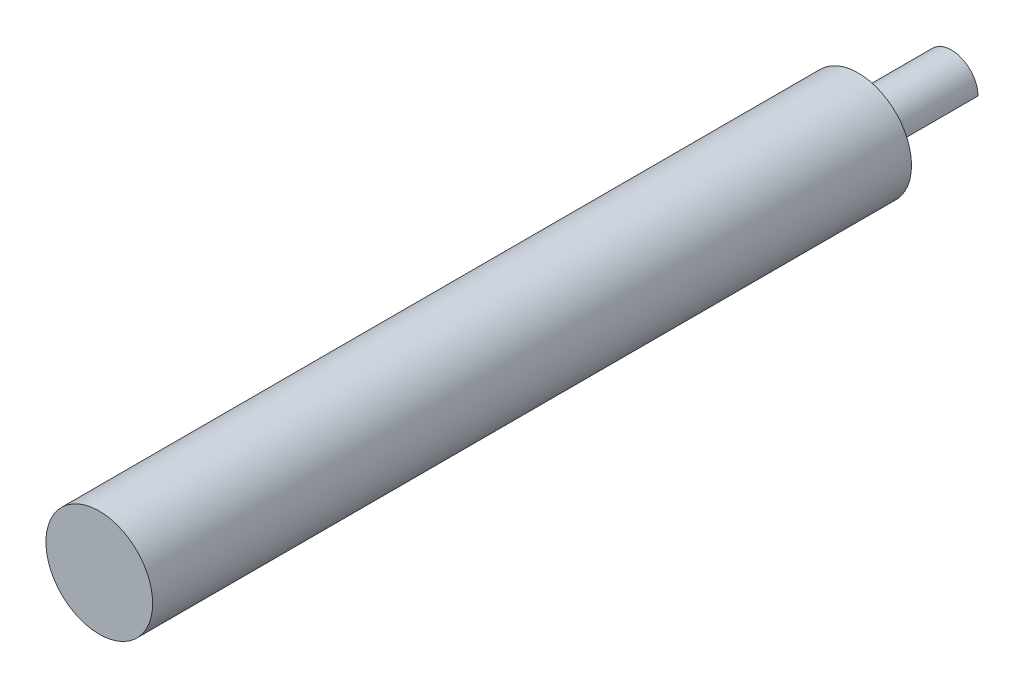
from build123d import *

# Parameters (mm, degrees)
SKETCH1_R               = 3.1623
BOSS_EXTRUDE1_DEPTH     = 11.0998
CUT_EXTRUDE1_DEPTH      = 12.96686436
CUT_EXTRUDE1_DEPTH_BACK = 12.96686436
SKETCH3_R               = 6.35
BOSS_EXTRUDE2_DEPTH     = 90.297
FILLET1_R               = 1.27


with BuildPart() as part:
    # Sketch1 → Boss-Extrude1 (new body)
    with BuildSketch(Plane.XY):
        Circle(SKETCH1_R)
    extrude(amount=BOSS_EXTRUDE1_DEPTH)

    # Sketch2 → Cut-Extrude1 (cut, two sides: drawn at the far end of the back side and taken through both)
    with BuildSketch(Plane(origin=(0, 0, 0), x_dir=(-1, 0, 0), z_dir=(0, 0, -1)).offset(-CUT_EXTRUDE1_DEPTH_BACK)):
        Polygon((17.073178183, -20.234228338), (0.001249598, -3.162299753), (-3.162299753, 0.001249598), (-20.234228338, 17.073178183), (-54.378085507, -17.070678986), (-17.070678986, -54.378085507), align=None)
    extrude(amount=CUT_EXTRUDE1_DEPTH + CUT_EXTRUDE1_DEPTH_BACK, mode=Mode.SUBTRACT)

    # Sketch3 → Boss-Extrude2 (add)
    with BuildSketch(Plane.XY.offset(11.0998)):
        Circle(SKETCH3_R)
    extrude(amount=BOSS_EXTRUDE2_DEPTH)

    # Fillet1
    fillet1_edges = [part.edges().sort_by_distance(p)[0] for p in [
        (-2.236083774, 2.236083774, 11.0998),
        (1.580525077, -1.580525077, 11.0998),
    ]]
    fillet(fillet1_edges, radius=FILLET1_R)


solid = part.part
